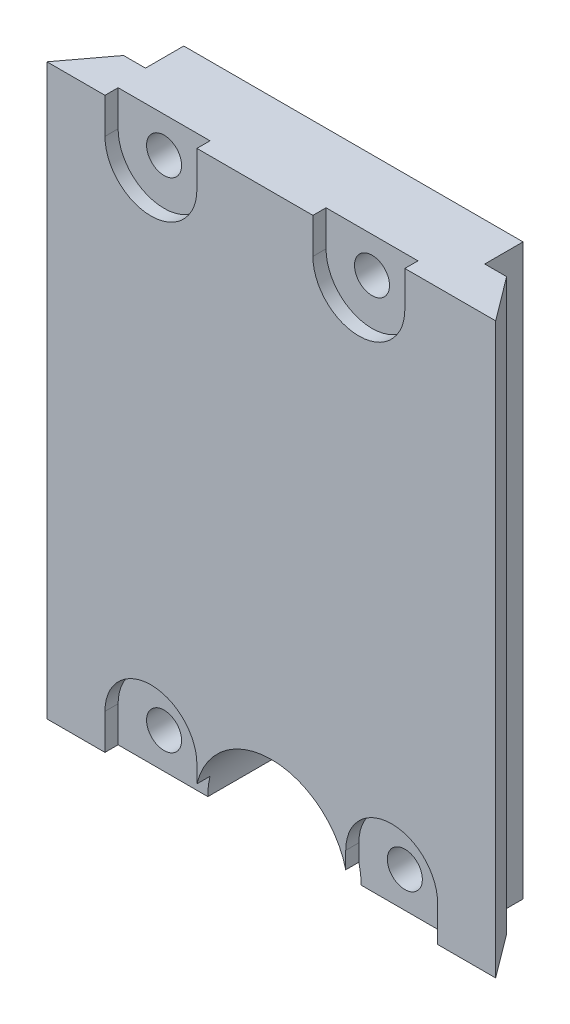
from build123d import *

# Parameters (mm, degrees)
EXTRUDE_1_DEPTH     = 52
SKETCH_3_W          = 31
SKETCH_3_H          = 52
EXTRUDE_2_DEPTH     = 3.5
CUT_EXTRUDE_1_REACH = 68.643
SKETCH_4_R          = 1.6
SKETCH_6_R          = 7
CUT_EXTRUDE_2_DEPTH = 67.642704027
SKETCH_7_R          = 4
CUT_EXTRUDE_3_DEPTH = 1.2
CUT_EXTRUDE_4_REACH = 68.518


with BuildPart() as part:
    # 草图2 → 凸台-拉伸1 (new body)
    with BuildSketch(Plane(origin=(0, 0, 0), x_dir=(1, 0, 0), z_dir=(0, 1, 0))):
        Polygon((0, 0), (41, 0), (38, 4), (3, 4), align=None)
    extrude(amount=EXTRUDE_1_DEPTH)

    # 草图3 → 凸台-拉伸2 (add)
    with BuildSketch(Plane(origin=(0, 0, -4), x_dir=(-1, 0, 0), z_dir=(0, 0, -1))):
        with Locations((-20.5, 26)):
            Rectangle(SKETCH_3_W, SKETCH_3_H)
    extrude(amount=EXTRUDE_2_DEPTH)

    # 草图4 → 切除-拉伸1 (cut, up to next)
    with BuildSketch(Plane.XY, mode=Mode.PRIVATE) as cut_extrude_1_sk1:
        with Locations((9.5, 3.25)):
            Circle(SKETCH_4_R)
    cut_extrude_1_tool1 = extrude(cut_extrude_1_sk1.sketch, amount=-CUT_EXTRUDE_1_REACH, mode=Mode.PRIVATE) & part.part
    # 草图4 → 切除-拉伸1 (cut, up to next)
    with BuildSketch(Plane.XY, mode=Mode.PRIVATE) as cut_extrude_1_sk2:
        with Locations((31.5, 3.25)):
            Circle(SKETCH_4_R)
    cut_extrude_1_tool2 = extrude(cut_extrude_1_sk2.sketch, amount=-CUT_EXTRUDE_1_REACH, mode=Mode.PRIVATE) & part.part
    # 草图4 → 切除-拉伸1 (cut, up to next)
    with BuildSketch(Plane.XY, mode=Mode.PRIVATE) as cut_extrude_1_sk3:
        with Locations((9.5, 48.75)):
            Circle(SKETCH_4_R)
    cut_extrude_1_tool3 = extrude(cut_extrude_1_sk3.sketch, amount=-CUT_EXTRUDE_1_REACH, mode=Mode.PRIVATE) & part.part
    # 草图4 → 切除-拉伸1 (cut, up to next)
    with BuildSketch(Plane.XY, mode=Mode.PRIVATE) as cut_extrude_1_sk4:
        with Locations((28.5, 48.75)):
            Circle(SKETCH_4_R)
    cut_extrude_1_tool4 = extrude(cut_extrude_1_sk4.sketch, amount=-CUT_EXTRUDE_1_REACH, mode=Mode.PRIVATE) & part.part
    add(cut_extrude_1_tool1.solids().sort_by_distance((9.5, 3.25, 0))[0], mode=Mode.SUBTRACT)
    add(cut_extrude_1_tool2.solids().sort_by_distance((31.5, 3.25, 0))[0], mode=Mode.SUBTRACT)
    add(cut_extrude_1_tool3.solids().sort_by_distance((9.5, 48.75, 0))[0], mode=Mode.SUBTRACT)
    add(cut_extrude_1_tool4.solids().sort_by_distance((28.5, 48.75, 0))[0], mode=Mode.SUBTRACT)

    # 草图6 → 切除-拉伸2 (cut, through all)
    with BuildSketch(Plane.XY):
        with Locations((20.5, 0.05)):
            Circle(SKETCH_6_R)
    extrude(amount=-CUT_EXTRUDE_2_DEPTH, mode=Mode.SUBTRACT)

    # 草图7 → 切除-拉伸3 (cut)
    with BuildSketch(Plane.XY):
        with Locations((9.5, 48.75)):
            Circle(SKETCH_7_R)
        with Locations((28.5, 48.75)):
            Circle(SKETCH_7_R)
        with Locations((9.5, 3.25)):
            Circle(SKETCH_7_R)
        with Locations((31.5, 3.25)):
            Circle(SKETCH_7_R)
    extrude(amount=-CUT_EXTRUDE_3_DEPTH, mode=Mode.SUBTRACT)

    # 草图8 → 切除-拉伸4 (cut, up to next)
    with BuildSketch(Plane.XY.offset(-1.2), mode=Mode.PRIVATE) as cut_extrude_4_sk1:
        with BuildLine():
            Line((5.3, 48.75), (5.3, 52))
            ThreePointArc((5.3, 52), (9.5, 56.2), (13.7, 52))
            Line((13.7, 52), (13.7, 48.75))
            ThreePointArc((13.7, 48.75), (9.5, 44.55), (5.3, 48.75))
        make_face()
    cut_extrude_4_tool1 = extrude(cut_extrude_4_sk1.sketch, amount=CUT_EXTRUDE_4_REACH, mode=Mode.PRIVATE) & part.part
    # 草图8 → 切除-拉伸4 (cut, up to next)
    with BuildSketch(Plane.XY.offset(-1.2), mode=Mode.PRIVATE) as cut_extrude_4_sk2:
        with BuildLine():
            Line((24.3, 48.75), (24.3, 52))
            ThreePointArc((24.3, 52), (28.5, 56.2), (32.7, 52))
            Line((32.7, 52), (32.7, 48.75))
            ThreePointArc((32.7, 48.75), (28.5, 44.55), (24.3, 48.75))
        make_face()
    cut_extrude_4_tool2 = extrude(cut_extrude_4_sk2.sketch, amount=CUT_EXTRUDE_4_REACH, mode=Mode.PRIVATE) & part.part
    # 草图8 → 切除-拉伸4 (cut, up to next)
    with BuildSketch(Plane.XY.offset(-1.2), mode=Mode.PRIVATE) as cut_extrude_4_sk3:
        with BuildLine():
            Line((13.7, 3.25), (13.7, 0))
            ThreePointArc((13.7, 0), (9.5, -4.2), (5.3, 0))
            Line((5.3, 0), (5.3, 3.25))
            ThreePointArc((5.3, 3.25), (9.5, 7.45), (13.7, 3.25))
        make_face()
    cut_extrude_4_tool3 = extrude(cut_extrude_4_sk3.sketch, amount=CUT_EXTRUDE_4_REACH, mode=Mode.PRIVATE) & part.part
    # 草图8 → 切除-拉伸4 (cut, up to next)
    with BuildSketch(Plane.XY.offset(-1.2), mode=Mode.PRIVATE) as cut_extrude_4_sk4:
        with BuildLine():
            Line((35.7, 3.25), (35.7, 0))
            ThreePointArc((35.7, 0), (31.5, -4.2), (27.3, 0))
            Line((27.3, 0), (27.3, 3.25))
            ThreePointArc((27.3, 3.25), (31.5, 7.45), (35.7, 3.25))
        make_face()
    cut_extrude_4_tool4 = extrude(cut_extrude_4_sk4.sketch, amount=CUT_EXTRUDE_4_REACH, mode=Mode.PRIVATE) & part.part
    add(cut_extrude_4_tool1.solids().sort_by_distance((9.5, 50.375, -1.2))[0], mode=Mode.SUBTRACT)
    add(cut_extrude_4_tool2.solids().sort_by_distance((28.5, 50.375, -1.2))[0], mode=Mode.SUBTRACT)
    add(cut_extrude_4_tool3.solids().sort_by_distance((9.5, 1.625, -1.2))[0], mode=Mode.SUBTRACT)
    add(cut_extrude_4_tool4.solids().sort_by_distance((31.5, 1.625, -1.2))[0], mode=Mode.SUBTRACT)


solid = part.part
